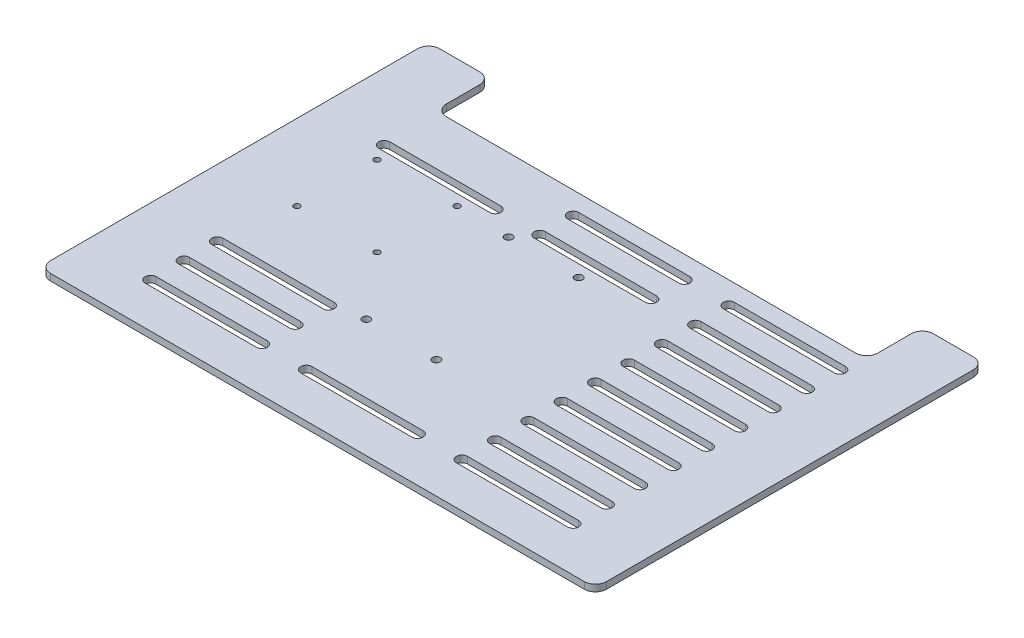
from build123d import *

# Parameters (mm, degrees)
EXTRUDE_1_DEPTH     = 3
FILLET_1_R          = 5
SKETCH_4_R          = 1.75
SKETCH_4_R_2        = 1.35
CUT_EXTRUDE_2_DEPTH = 10
CUT_EXTRUDE_3_DEPTH = 10


with BuildPart() as part:
    # 草图1 → 凸台-拉伸1 (new body)
    with BuildSketch(Plane(origin=(0, 0, 0), x_dir=(1, 0, 0), z_dir=(0, 1, 0))):
        Polygon((-84.734156599, 82.359506041), (109.265843401, 82.359506041), (109.265843401, 107.359506041), (137.265843401, 107.359506041), (137.265843401, 82.359506041), (137.265843401, -67.640493959), (-112.734156599, -67.640493959), (-112.734156599, 55.552013884), (-112.734156599, 107.359506041), (-84.734156599, 107.359506041), align=None)
    extrude(amount=EXTRUDE_1_DEPTH)

    # 圆角1
    fillet_1_edges = [part.edges().sort_by_distance(p)[0] for p in [
        (137.265843401, 1.5, 67.640493959),
        (-112.734156599, 1.5, 67.640493959),
        (137.265843401, 1.5, -107.359506041),
        (109.265843401, 1.5, -107.359506041),
        (109.265843401, 1.5, -82.359506041),
        (-112.734156599, 1.5, -107.359506041),
        (-84.734156599, 1.5, -107.359506041),
        (-84.734156599, 1.5, -82.359506041),
    ]]
    fillet(fillet_1_edges, radius=FILLET_1_R)

    # 草图4 → 切除-拉伸2 (cut)
    with BuildSketch(Plane(origin=(0, 3, 0), x_dir=(1, 0, 0), z_dir=(0, 1, 0))):
        with Locations((-18.891317384, -14.5)):
            Circle(SKETCH_4_R)
        with Locations((12.608682616, -14.5)):
            Circle(SKETCH_4_R)
        with Locations((-42.582797937, 49.995)):
            Circle(SKETCH_4_R_2)
        with Locations((-18.891317384, 49.5)):
            Circle(SKETCH_4_R)
        with Locations((12.608682616, 49.5)):
            Circle(SKETCH_4_R)
        with Locations((-42.582797937, 13.995)):
            Circle(SKETCH_4_R_2)
        with Locations((-78.582797937, 13.995)):
            Circle(SKETCH_4_R_2)
        with Locations((-78.582797937, 49.995)):
            Circle(SKETCH_4_R_2)
    extrude(amount=-CUT_EXTRUDE_2_DEPTH, mode=Mode.SUBTRACT)

    # 草图4<3> → 切除-拉伸3 (cut)
    with BuildSketch(Plane(origin=(0, 3, 0), x_dir=(1, 0, 0), z_dir=(0, 1, 0))):
        with BuildLine():
            Line((57.265843401, 74.859506041), (107.265843401, 74.859506041))
            ThreePointArc((107.265843401, 74.859506041), (109.765843401, 72.359506041), (107.265843401, 69.859506041))
            Line((107.265843401, 69.859506041), (57.265843401, 69.859506041))
            ThreePointArc((57.265843401, 69.859506041), (54.765843401, 72.359506041), (57.265843401, 74.859506041))
        make_face()
        with BuildLine():
            Line((57.265843401, 59.859506041), (107.265843401, 59.859506041))
            ThreePointArc((107.265843401, 59.859506041), (109.765843401, 57.359506041), (107.265843401, 54.859506041))
            Line((107.265843401, 54.859506041), (57.265843401, 54.859506041))
            ThreePointArc((57.265843401, 54.859506041), (54.765843401, 57.359506041), (57.265843401, 59.859506041))
        make_face()
        with BuildLine():
            Line((57.265843401, 44.859506041), (107.265843401, 44.859506041))
            ThreePointArc((107.265843401, 44.859506041), (109.765843401, 42.359506041), (107.265843401, 39.859506041))
            Line((107.265843401, 39.859506041), (57.265843401, 39.859506041))
            ThreePointArc((57.265843401, 39.859506041), (54.765843401, 42.359506041), (57.265843401, 44.859506041))
        make_face()
        with BuildLine():
            Line((57.265843401, 29.859506041), (107.265843401, 29.859506041))
            ThreePointArc((107.265843401, 29.859506041), (109.765843401, 27.359506041), (107.265843401, 24.859506041))
            Line((107.265843401, 24.859506041), (57.265843401, 24.859506041))
            ThreePointArc((57.265843401, 24.859506041), (54.765843401, 27.359506041), (57.265843401, 29.859506041))
        make_face()
        with BuildLine():
            Line((57.265843401, 14.859506041), (107.265843401, 14.859506041))
            ThreePointArc((107.265843401, 14.859506041), (109.765843401, 12.359506041), (107.265843401, 9.859506041))
            Line((107.265843401, 9.859506041), (57.265843401, 9.859506041))
            ThreePointArc((57.265843401, 9.859506041), (54.765843401, 12.359506041), (57.265843401, 14.859506041))
        make_face()
        with BuildLine():
            Line((57.265843401, -0.140493959), (107.265843401, -0.140493959))
            ThreePointArc((107.265843401, -0.140493959), (109.765843401, -2.640493959), (107.265843401, -5.140493959))
            Line((107.265843401, -5.140493959), (57.265843401, -5.140493959))
            ThreePointArc((57.265843401, -5.140493959), (54.765843401, -2.640493959), (57.265843401, -0.140493959))
        make_face()
        with BuildLine():
            Line((57.265843401, -15.140493959), (107.265843401, -15.140493959))
            ThreePointArc((107.265843401, -15.140493959), (109.765843401, -17.640493959), (107.265843401, -20.140493959))
            Line((107.265843401, -20.140493959), (57.265843401, -20.140493959))
            ThreePointArc((57.265843401, -20.140493959), (54.765843401, -17.640493959), (57.265843401, -15.140493959))
        make_face()
        with BuildLine():
            Line((57.265843401, -30.140493959), (107.265843401, -30.140493959))
            ThreePointArc((107.265843401, -30.140493959), (109.765843401, -32.640493959), (107.265843401, -35.140493959))
            Line((107.265843401, -35.140493959), (57.265843401, -35.140493959))
            ThreePointArc((57.265843401, -35.140493959), (54.765843401, -32.640493959), (57.265843401, -30.140493959))
        make_face()
        with BuildLine():
            Line((57.265843401, -45.140493959), (107.265843401, -45.140493959))
            ThreePointArc((107.265843401, -45.140493959), (109.765843401, -47.640493959), (107.265843401, -50.140493959))
            Line((107.265843401, -50.140493959), (57.265843401, -50.140493959))
            ThreePointArc((57.265843401, -50.140493959), (54.765843401, -47.640493959), (57.265843401, -45.140493959))
        make_face()
        with BuildLine():
            Line((-12.734156599, 74.859506041), (37.265843401, 74.859506041))
            ThreePointArc((37.265843401, 74.859506041), (39.765843401, 72.359506041), (37.265843401, 69.859506041))
            Line((37.265843401, 69.859506041), (-12.734156599, 69.859506041))
            ThreePointArc((-12.734156599, 69.859506041), (-15.234156599, 72.359506041), (-12.734156599, 74.859506041))
        make_face()
        with BuildLine():
            Line((-12.734156599, 59.859506041), (37.265843401, 59.859506041))
            ThreePointArc((37.265843401, 59.859506041), (39.765843401, 57.359506041), (37.265843401, 54.859506041))
            Line((37.265843401, 54.859506041), (-12.734156599, 54.859506041))
            ThreePointArc((-12.734156599, 54.859506041), (-15.234156599, 57.359506041), (-12.734156599, 59.859506041))
        make_face()
        with BuildLine():
            Line((-82.734156599, 59.859506041), (-32.734156599, 59.859506041))
            ThreePointArc((-32.734156599, 59.859506041), (-30.234156599, 57.359506041), (-32.734156599, 54.859506041))
            Line((-32.734156599, 54.859506041), (-82.734156599, 54.859506041))
            ThreePointArc((-82.734156599, 54.859506041), (-85.234156599, 57.359506041), (-82.734156599, 59.859506041))
        make_face()
        with BuildLine():
            Line((-12.734156599, -45.140493959), (37.265843401, -45.140493959))
            ThreePointArc((37.265843401, -45.140493959), (39.765843401, -47.640493959), (37.265843401, -50.140493959))
            Line((37.265843401, -50.140493959), (-12.734156599, -50.140493959))
            ThreePointArc((-12.734156599, -50.140493959), (-15.234156599, -47.640493959), (-12.734156599, -45.140493959))
        make_face()
        with BuildLine():
            Line((-82.734156599, -45.140493959), (-32.734156599, -45.140493959))
            ThreePointArc((-32.734156599, -45.140493959), (-30.234156599, -47.640493959), (-32.734156599, -50.140493959))
            Line((-32.734156599, -50.140493959), (-82.734156599, -50.140493959))
            ThreePointArc((-82.734156599, -50.140493959), (-85.234156599, -47.640493959), (-82.734156599, -45.140493959))
        make_face()
        with BuildLine():
            Line((-82.734156599, -30.140493959), (-32.734156599, -30.140493959))
            ThreePointArc((-32.734156599, -30.140493959), (-30.234156599, -32.640493959), (-32.734156599, -35.140493959))
            Line((-32.734156599, -35.140493959), (-82.734156599, -35.140493959))
            ThreePointArc((-82.734156599, -35.140493959), (-85.234156599, -32.640493959), (-82.734156599, -30.140493959))
        make_face()
        with BuildLine():
            Line((-82.734156599, -15.140493959), (-32.734156599, -15.140493959))
            ThreePointArc((-32.734156599, -15.140493959), (-30.234156599, -17.640493959), (-32.734156599, -20.140493959))
            Line((-32.734156599, -20.140493959), (-82.734156599, -20.140493959))
            ThreePointArc((-82.734156599, -20.140493959), (-85.234156599, -17.640493959), (-82.734156599, -15.140493959))
        make_face()
    extrude(amount=-CUT_EXTRUDE_3_DEPTH, mode=Mode.SUBTRACT)


solid = part.part
